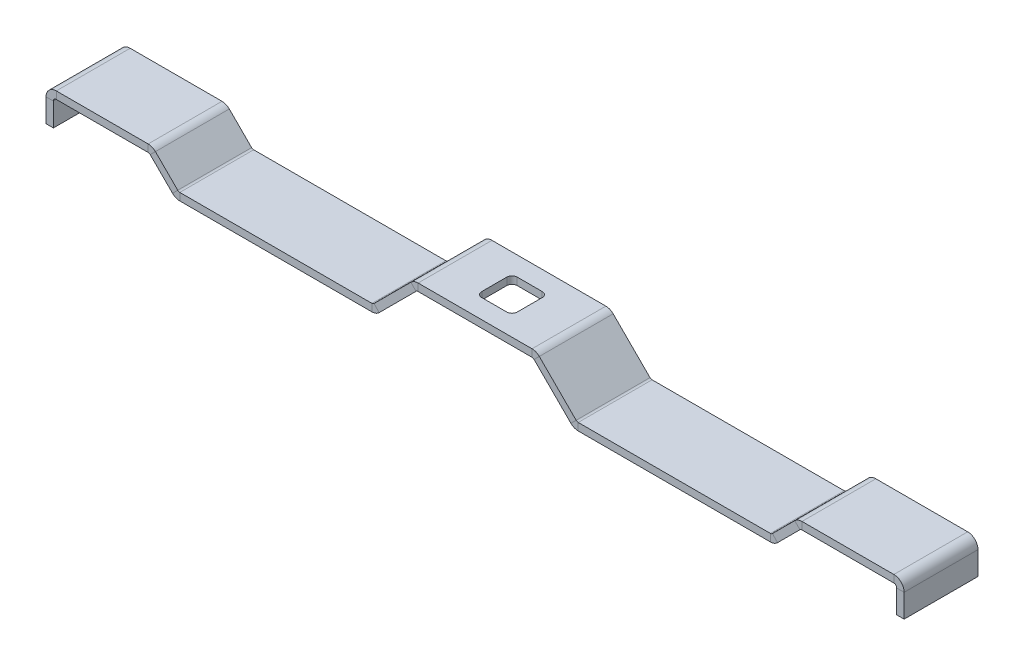
from build123d import *

# Parameters (mm, degrees)
BOSS_EXTRUDE1_DEPTH    = 12.7
CUT_EXTRUDE1_DEPTH     = 12.7
CONVERT_SOLID1_DEPTH   = 12.7
CONVERT_SOLID1_2_DEPTH = 12.7


# Read off the part's stored shape, not the designer's step: Convert-Solid1
with BuildPart() as part:
    # Sketch1 → Boss-Extrude1 (new body)
    with BuildSketch(Plane.XY):
        Polygon((0, 0), (10, 0), (17, -7), (51.5, -7), (56, -2.5), (72.5, -2.5), (72.5, -7), (73.77, -7), (73.77, -1.23), (55.473948776, -1.23), (50.973948776, -5.73), (17.526051224, -5.73), (10.526051224, 1.27), (0, 1.27), (-10.526051224, 1.27), (-17.526051224, -5.73), (-50.973948776, -5.73), (-55.473948776, -1.23), (-73.77, -1.23), (-73.77, -7), (-72.5, -7), (-72.5, -2.5), (-56, -2.5), (-51.5, -7), (-17, -7), (-10, 0), align=None)
    extrude(amount=BOSS_EXTRUDE1_DEPTH)

    # Sketch2 → Cut-Extrude1 (cut)
    with BuildSketch(Plane(origin=(0, 1.27, 0), x_dir=(1, 0, 0), z_dir=(0, 1, 0))):
        with BuildLine():
            Line((-2.15, -3.3), (2.15, -3.3))
            ThreePointArc((2.15, -3.3), (2.786396103, -3.563603897), (3.05, -4.2))
            Line((3.05, -4.2), (3.05, -8.5))
            ThreePointArc((3.05, -8.5), (2.786396103, -9.136396103), (2.15, -9.4))
            Line((2.15, -9.4), (-2.15, -9.4))
            ThreePointArc((-2.15, -9.4), (-2.786396103, -9.136396103), (-3.05, -8.5))
            Line((-3.05, -8.5), (-3.05, -4.2))
            ThreePointArc((-3.05, -4.2), (-2.786396103, -3.563603897), (-2.15, -3.3))
        make_face()
    extrude(amount=-CUT_EXTRUDE1_DEPTH, mode=Mode.SUBTRACT)

    # Convert-Solid1 outline → Convert-Solid1 (cut)
    with BuildSketch(Plane.XY):
        with BuildLine():
            Line((73.77, -1.23), (72, -1.23))
            ThreePointArc((72, -1.23), (73.251579003, -1.748420997), (73.77, -3))
            Line((73.77, -3), (73.77, -1.23))
        make_face()
        with BuildLine():
            ThreePointArc((54.955527778, -1.748420997), (55.529757106, -1.364733227), (56.207106781, -1.23))
            Line((56.207106781, -1.23), (55.473948776, -1.23))
            Line((55.473948776, -1.23), (54.955527778, -1.748420997))
        make_face()
        with BuildLine():
            ThreePointArc((9.792893219, 1.27), (10.470242894, 1.135266773), (11.044472222, 0.751579003))
            Line((11.044472222, 0.751579003), (10.526051224, 1.27))
            Line((10.526051224, 1.27), (9.792893219, 1.27))
        make_face()
        with BuildLine():
            Line((51.5, -7), (52.018420997, -6.481579003))
            ThreePointArc((52.018420997, -6.481579003), (51.44419167, -6.865266773), (50.766841995, -7))
            Line((50.766841995, -7), (51.5, -7))
        make_face()
        with BuildLine():
            ThreePointArc((-11.044472222, 0.751579003), (-10.470242894, 1.135266773), (-9.792893219, 1.27))
            Line((-9.792893219, 1.27), (-10.526051224, 1.27))
            Line((-10.526051224, 1.27), (-11.044472222, 0.751579003))
        make_face()
        with BuildLine():
            Line((17, -7), (17.733158005, -7))
            ThreePointArc((17.733158005, -7), (17.05580833, -6.865266773), (16.481579003, -6.481579003))
            Line((16.481579003, -6.481579003), (17, -7))
        make_face()
        with BuildLine():
            ThreePointArc((-56.207106781, -1.23), (-55.529757106, -1.364733227), (-54.955527778, -1.748420997))
            Line((-54.955527778, -1.748420997), (-55.473948776, -1.23))
            Line((-55.473948776, -1.23), (-56.207106781, -1.23))
        make_face()
        with BuildLine():
            Line((-17, -7), (-16.481579003, -6.481579003))
            ThreePointArc((-16.481579003, -6.481579003), (-17.05580833, -6.865266773), (-17.733158005, -7))
            Line((-17.733158005, -7), (-17, -7))
        make_face()
        with BuildLine():
            ThreePointArc((-73.77, -3), (-73.251579003, -1.748420997), (-72, -1.23))
            Line((-72, -1.23), (-73.77, -1.23))
            Line((-73.77, -1.23), (-73.77, -3))
        make_face()
        with BuildLine():
            Line((-51.5, -7), (-50.766841995, -7))
            ThreePointArc((-50.766841995, -7), (-51.44419167, -6.865266773), (-52.018420997, -6.481579003))
            Line((-52.018420997, -6.481579003), (-51.5, -7))
        make_face()
    extrude(amount=CONVERT_SOLID1_DEPTH, mode=Mode.SUBTRACT)

    # Convert-Solid1 2 outline → Convert-Solid1 2 (add)
    with BuildSketch(Plane.XY):
        with BuildLine():
            Line((50.973948776, -5.73), (51.120395385, -5.583553391))
            ThreePointArc((51.120395385, -5.583553391), (50.958183711, -5.691939766), (50.766841995, -5.73))
            Line((50.766841995, -5.73), (50.973948776, -5.73))
        make_face()
        with BuildLine():
            ThreePointArc((72, -2.5), (72.353553391, -2.646446609), (72.5, -3))
            Line((72.5, -3), (72.5, -2.5))
            Line((72.5, -2.5), (72, -2.5))
        make_face()
        with BuildLine():
            Line((17.526051224, -5.73), (17.733158005, -5.73))
            ThreePointArc((17.733158005, -5.73), (17.541816289, -5.691939766), (17.379604615, -5.583553391))
            Line((17.379604615, -5.583553391), (17.526051224, -5.73))
        make_face()
        with BuildLine():
            ThreePointArc((55.853553391, -2.646446609), (56.015765065, -2.538060234), (56.207106781, -2.5))
            Line((56.207106781, -2.5), (56, -2.5))
            Line((56, -2.5), (55.853553391, -2.646446609))
        make_face()
        with BuildLine():
            Line((-17.526051224, -5.73), (-17.379604615, -5.583553391))
            ThreePointArc((-17.379604615, -5.583553391), (-17.541816289, -5.691939766), (-17.733158005, -5.73))
            Line((-17.733158005, -5.73), (-17.526051224, -5.73))
        make_face()
        with BuildLine():
            ThreePointArc((9.792893219, 0), (9.984234935, -0.038060234), (10.146446609, -0.146446609))
            Line((10.146446609, -0.146446609), (10, 0))
            Line((10, 0), (9.792893219, 0))
        make_face()
        with BuildLine():
            Line((-50.973948776, -5.73), (-50.766841995, -5.73))
            ThreePointArc((-50.766841995, -5.73), (-50.958183711, -5.691939766), (-51.120395385, -5.583553391))
            Line((-51.120395385, -5.583553391), (-50.973948776, -5.73))
        make_face()
        with BuildLine():
            ThreePointArc((-10.146446609, -0.146446609), (-9.984234935, -0.038060234), (-9.792893219, 0))
            Line((-9.792893219, 0), (-10, 0))
            Line((-10, 0), (-10.146446609, -0.146446609))
        make_face()
        with BuildLine():
            ThreePointArc((-56.207106781, -2.5), (-56.015765065, -2.538060234), (-55.853553391, -2.646446609))
            Line((-55.853553391, -2.646446609), (-56, -2.5))
            Line((-56, -2.5), (-56.207106781, -2.5))
        make_face()
        with BuildLine():
            Line((-72.5, -2.5), (-72.5, -3))
            ThreePointArc((-72.5, -3), (-72.353553391, -2.646446609), (-72, -2.5))
            Line((-72, -2.5), (-72.5, -2.5))
        make_face()
    extrude(amount=CONVERT_SOLID1_2_DEPTH)


solid = part.part
